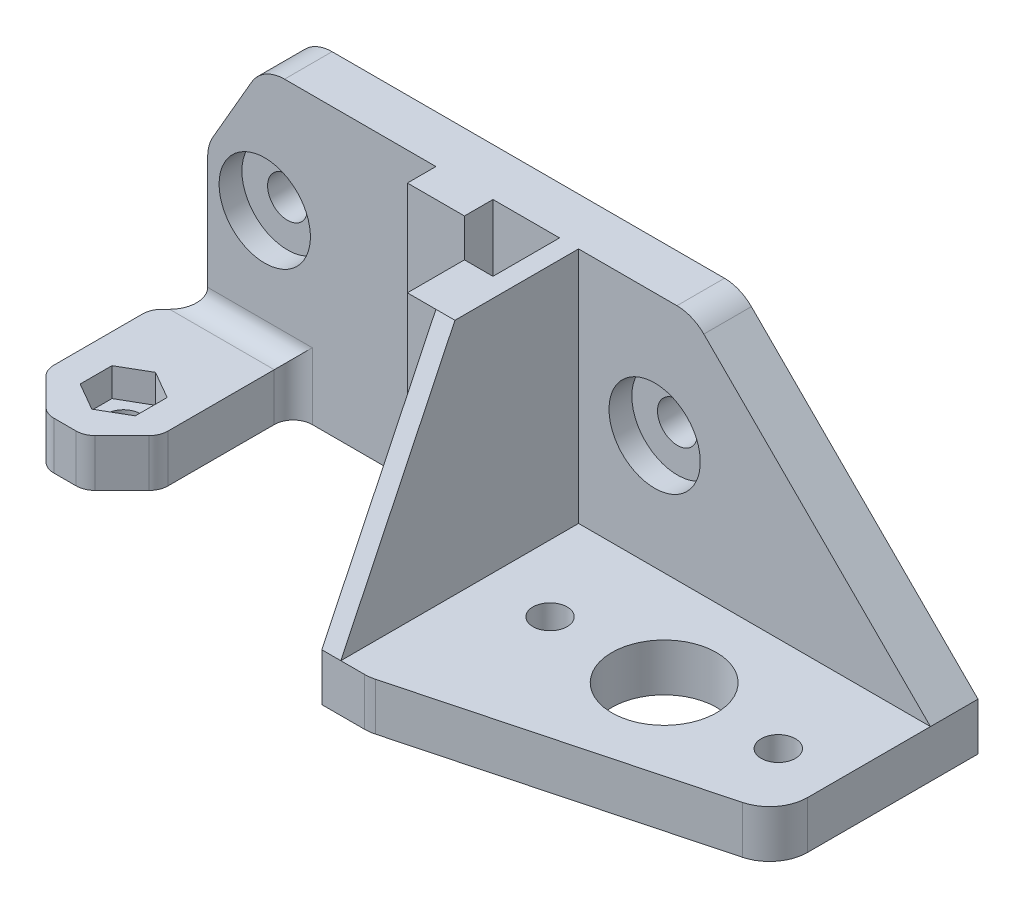
from build123d import *

# Parameters (mm, degrees)
SKETCH1_W                     = 30
SKETCH1_H                     = 30
BOSS_EXTRUDE1_DEPTH           = 30
SKETCH2_W                     = 20
SKETCH2_H                     = 20
CUT_EXTRUDE1_DEPTH            = 37.742346142
SKETCH3_W                     = 30
SKETCH3_H                     = 5
BOSS_EXTRUDE2_DEPTH           = 40
SKETCH4_R                     = 5.5
SKETCH4_R_2                   = 1.8
CUT_EXTRUDE2_DEPTH            = 65.420493634
CUT_EXTRUDE3_DEPTH            = 63.24949799
SKETCH5_W                     = 5
SKETCH5_H                     = 25
BOSS_EXTRUDE4_DEPTH           = 34
CHAMFER1_SIZE                 = 25
SKETCH8_R                     = 2.1
CUT_EXTRUDE4_DEPTH            = 63.657800791
SKETCH9_W                     = 5
SKETCH9_H                     = 30
BOSS_EXTRUDE5_DEPTH           = 12
CHAMFER2_SIZE                 = 10
CHAMFER2_SIZE2                = 5.773502692
SKETCH10_R                    = 2.1
CUT_EXTRUDE5_DEPTH            = 63.657800791
BODY_MOVE_COPY1_OUTLINE_R     = 1.8
BODY_MOVE_COPY1_OUTLINE_R_2   = 5.5
BODY_MOVE_COPY1_DEPTH         = 27.5685
BODY_MOVE_COPY1_2_OUTLINE_R   = 1.8
BODY_MOVE_COPY1_2_OUTLINE_R_2 = 5.5
BODY_MOVE_COPY1_2_DEPTH       = 5
BODY_MOVE_COPY1_START         = -15
BODY_MOVE_COPY1_3_DEPTH       = 5
BODY_MOVE_COPY1_4_DEPTH       = 5
SKETCH11_W                    = 3
SKETCH11_H                    = 25
CUT_EXTRUDE6_DEPTH            = 25
SKETCH12_W                    = 25
SKETCH12_H                    = 25
CUT_EXTRUDE7_DEPTH            = 60.380131357
SKETCH13_W                    = 3
SKETCH13_H                    = 6
SKETCH13_W_2                  = 6
SKETCH13_H_2                  = 3
BOSS_EXTRUDE6_DEPTH           = 30
SKETCH14_R                    = 4.8
CUT_EXTRUDE9_DEPTH            = 2.4
CHAMFER3_SIZE                 = 12
CHAMFER3_SIZE2                = 25
FILLET1_R                     = 4
FILLET2_R                     = 4
BODY_MOVE_COPY2_OUTLINE_R     = 1.8
BODY_MOVE_COPY2_OUTLINE_R_2   = 5.5
BODY_MOVE_COPY2_DEPTH         = 30
BODY_MOVE_COPY2_2_OUTLINE_R   = 1.8
BODY_MOVE_COPY2_2_OUTLINE_R_2 = 5.5
BODY_MOVE_COPY2_2_DEPTH       = 5
BODY_MOVE_COPY2_START         = -15
BODY_MOVE_COPY2_3_DEPTH       = 5
BODY_MOVE_COPY2_START_2       = -3
BODY_MOVE_COPY2_4_OUTLINE_W   = 5
BODY_MOVE_COPY2_4_OUTLINE_H   = 25
BODY_MOVE_COPY2_4_DEPTH       = 6
BODY_MOVE_COPY2_START_3       = -10
BODY_MOVE_COPY2_5_OUTLINE_W   = 2
BODY_MOVE_COPY2_5_OUTLINE_H   = 25
BODY_MOVE_COPY2_5_DEPTH       = 13
BODY_MOVE_COPY2_6_DEPTH       = 2.6
BODY_MOVE_COPY2_START_4       = 10
BODY_MOVE_COPY2_7_DEPTH       = 2
BODY_MOVE_COPY2_START_5       = 7
BODY_MOVE_COPY2_8_OUTLINE_W   = 25
BODY_MOVE_COPY2_8_OUTLINE_H   = 6
BODY_MOVE_COPY2_8_DEPTH       = 3.26576
BODY_MOVE_COPY2_START_6       = -16
BODY_MOVE_COPY2_9_DEPTH       = 6
BODY_MOVE_COPY2_START_7       = -12.4
BODY_MOVE_COPY2_10_DEPTH      = 2.4
SKETCH15_W                    = 13
SKETCH15_H                    = 5
BOSS_EXTRUDE7_DEPTH           = 18
SKETCH17_W                    = 23
SKETCH17_H                    = 5
BOSS_EXTRUDE8_DEPTH           = 3
SKETCH18_W                    = 4
SKETCH18_H                    = 18
CUT_EXTRUDE10_DEPTH           = 58.017541161
CHAMFER6_SIZE                 = 4
FILLET4_R                     = 2
SKETCH16_R                    = 1.8
CUT_EXTRUDE11_DEPTH           = 60.380131357
CUT_EXTRUDE12_DEPTH           = 3


with BuildPart() as part:
    # Sketch1 → Boss-Extrude1 (new body)
    with BuildSketch(Plane(origin=(0, 0, 0), x_dir=(1, 0, 0), z_dir=(0, 1, 0))):
        Rectangle(SKETCH1_W, SKETCH1_H)
    extrude(amount=BOSS_EXTRUDE1_DEPTH)

    # Sketch2 → Cut-Extrude1 (cut, through all)
    with BuildSketch(Plane(origin=(0, 30, 0), x_dir=(1, 0, 0), z_dir=(0, 1, 0))):
        Rectangle(SKETCH2_W, SKETCH2_H)
    extrude(amount=-CUT_EXTRUDE1_DEPTH, mode=Mode.SUBTRACT)

    # Sketch3 → Boss-Extrude2 (add)
    with BuildSketch(Plane(origin=(15, 0, 0), x_dir=(0, 0, -1), z_dir=(1, 0, 0))):
        with Locations((0, 2.5)):
            Rectangle(SKETCH3_W, SKETCH3_H)
    extrude(amount=BOSS_EXTRUDE2_DEPTH)

    # Sketch4 → Cut-Extrude2 (cut, through all)
    with BuildSketch(Plane.XZ):
        with Locations(Location((31, 0, 0), (0, 0, 270))):
            Circle(SKETCH4_R)
        with Locations(Location((19, 0, 0), (0, 0, 270))):
            Circle(SKETCH4_R_2)
        with Locations(Location((43, 0, 0), (0, 0, 270))):
            Circle(SKETCH4_R_2)
    extrude(amount=-CUT_EXTRUDE2_DEPTH, mode=Mode.SUBTRACT)

    # Sketch7 → Cut-Extrude3 (cut, through all)
    with BuildSketch(Plane(origin=(0, 5, 0), x_dir=(1, 0, 0), z_dir=(0, 1, 0))):
        Polygon((15, -15), (49, -6), (49, 15), (55, 15), (55, -15), align=None)
    extrude(amount=-CUT_EXTRUDE3_DEPTH, mode=Mode.SUBTRACT)

    # Sketch5 → Boss-Extrude4 (add)
    with BuildSketch(Plane(origin=(15, 0, 0), x_dir=(0, 0, -1), z_dir=(1, 0, 0))):
        with Locations((12.5, 17.5)):
            Rectangle(SKETCH5_W, SKETCH5_H)
    extrude(amount=BOSS_EXTRUDE4_DEPTH)

    # Chamfer1
    chamfer1_edges = [part.edges().sort_by_distance(p)[0] for p in [
        (49, 30, -12.5),
    ]]
    chamfer(chamfer1_edges, length=CHAMFER1_SIZE)

    # Sketch8 → Cut-Extrude4 (cut, through all)
    with BuildSketch(Plane.XY.offset(-10)):
        with Locations((20, 17)):
            Circle(SKETCH8_R)
    extrude(amount=-CUT_EXTRUDE4_DEPTH, mode=Mode.SUBTRACT)

    # Sketch9 → Boss-Extrude5 (add)
    with BuildSketch(Plane.ZY.offset(15)):
        with Locations((-12.5, 15)):
            Rectangle(SKETCH9_W, SKETCH9_H)
    extrude(amount=BOSS_EXTRUDE5_DEPTH)

    # Chamfer2
    chamfer2_edges = [part.edges().sort_by_distance(p)[0] for p in [
        (-27, 30, -12.5),
    ]]
    chamfer2_side = [part.faces().sort_by_distance(p)[0] for p in [
        (-27, 15, -12.5),
    ]]
    chamfer(chamfer2_edges, length=CHAMFER2_SIZE, length2=CHAMFER2_SIZE2, reference=chamfer2_side[0])

    # Sketch10 → Cut-Extrude5 (cut, through all)
    with BuildSketch(Plane.XY.offset(-10)):
        with Locations((-21, 17)):
            Circle(SKETCH10_R)
    extrude(amount=-CUT_EXTRUDE5_DEPTH, mode=Mode.SUBTRACT)

    # Body-Move/Copy1: read off the stored shape, not the designer's step
    # Body-Move/Copy1 outline → Body-Move/Copy1 (cut)
    with BuildSketch(Plane(origin=(0, 0, 0), x_dir=(1, 0, 0), z_dir=(0, 1, 0))):
        Polygon((27, 10), (15, 10), (15, -15), (49, -6), (49, 15), (27, 15), align=None)
        with Locations((19, 0)):
            Circle(BODY_MOVE_COPY1_OUTLINE_R, mode=Mode.SUBTRACT)
        with Locations((31, 0)):
            Circle(BODY_MOVE_COPY1_OUTLINE_R_2, mode=Mode.SUBTRACT)
        with Locations((43, 0)):
            Circle(BODY_MOVE_COPY1_OUTLINE_R, mode=Mode.SUBTRACT)
    extrude(amount=BODY_MOVE_COPY1_DEPTH, mode=Mode.SUBTRACT)

    # Body-Move_Copy1 2 outline → Body-Move_Copy1 2 (add)
    with BuildSketch(Plane(origin=(0, 0, 0), x_dir=(1, 0, 0), z_dir=(0, 1, 0))):
        Polygon((-27, 10), (-27, 15), (-49, 15), (-49, -6), (-15, -15), (-15, 10), align=None)
        with Locations((-19, 0)):
            Circle(BODY_MOVE_COPY1_2_OUTLINE_R, mode=Mode.SUBTRACT)
        with Locations((-43, 0)):
            Circle(BODY_MOVE_COPY1_2_OUTLINE_R, mode=Mode.SUBTRACT)
        with Locations((-31, 0)):
            Circle(BODY_MOVE_COPY1_2_OUTLINE_R_2, mode=Mode.SUBTRACT)
    extrude(amount=BODY_MOVE_COPY1_2_DEPTH)

    # Body-Move_Copy1 3 outline → Body-Move_Copy1 3 (cut)
    with BuildSketch(Plane.XY.offset(BODY_MOVE_COPY1_START)):
        Polygon((24, 30), (21.226497308, 30), (27, 20), (27, 27), align=None)
        with BuildLine():
            ThreePointArc((-20.5, 14.960392195), (-17.9, 17), (-20.5, 19.039607805))
            ThreePointArc((-20.5, 19.039607805), (-18.9, 17), (-20.5, 14.960392195))
        make_face()
        with BuildLine():
            ThreePointArc((20.5, 14.960392195), (23.1, 17), (20.5, 19.039607805))
            ThreePointArc((20.5, 19.039607805), (22.1, 17), (20.5, 14.960392195))
        make_face()
    extrude(amount=BODY_MOVE_COPY1_3_DEPTH, mode=Mode.SUBTRACT)

    # Body-Move_Copy1 4 outline → Body-Move_Copy1 4 (add)
    with BuildSketch(Plane.XY.offset(BODY_MOVE_COPY1_START)):
        Polygon((-27, 20), (-21.226497308, 30), (-24, 30), (-49, 5), (-27, 5), align=None)
        with BuildLine():
            ThreePointArc((-20.5, 14.960392195), (-22.1, 17), (-20.5, 19.039607805))
            ThreePointArc((-20.5, 19.039607805), (-23.1, 17), (-20.5, 14.960392195))
        make_face()
        with BuildLine():
            ThreePointArc((20.5, 14.960392195), (18.9, 17), (20.5, 19.039607805))
            ThreePointArc((20.5, 19.039607805), (17.9, 17), (20.5, 14.960392195))
        make_face()
    extrude(amount=BODY_MOVE_COPY1_4_DEPTH)

    # Sketch11 → Cut-Extrude6 (cut)
    with BuildSketch(Plane(origin=(0, 30, 0), x_dir=(1, 0, 0), z_dir=(0, 1, 0))):
        with Locations((-13.5, -2.5)):
            Rectangle(SKETCH11_W, SKETCH11_H)
    extrude(amount=-CUT_EXTRUDE6_DEPTH, mode=Mode.SUBTRACT)

    # Sketch12 → Cut-Extrude7 (cut, through all)
    with BuildSketch(Plane(origin=(0, 30, 0), x_dir=(1, 0, 0), z_dir=(0, 1, 0))):
        with Locations((2.5, -2.5)):
            Rectangle(SKETCH12_W, SKETCH12_H)
    extrude(amount=-CUT_EXTRUDE7_DEPTH, mode=Mode.SUBTRACT)

    # Sketch13 → Boss-Extrude6 (add)
    with BuildSketch(Plane(origin=(0, 30, 0), x_dir=(1, 0, 0), z_dir=(0, 1, 0))):
        with Locations((-8.5, 0)):
            Rectangle(SKETCH13_W, SKETCH13_H)
        with Locations((0, 8.5)):
            Rectangle(SKETCH13_W_2, SKETCH13_H_2)
    extrude(amount=-BOSS_EXTRUDE6_DEPTH)

    # Sketch14 → Cut-Extrude9 (cut)
    with BuildSketch(Plane.XY.offset(-10)):
        with Locations((-20, 17)):
            Circle(SKETCH14_R)
        with Locations((21, 17)):
            Circle(SKETCH14_R)
    extrude(amount=-CUT_EXTRUDE9_DEPTH, mode=Mode.SUBTRACT)

    # Chamfer3
    chamfer3_edges = [part.edges().sort_by_distance(p)[0] for p in [
        (-11, 30, 15),
    ]]
    chamfer3_side = [part.faces().sort_by_distance(p)[0] for p in [
        (-18, 30, -10.542718717),
    ]]
    chamfer(chamfer3_edges, length=CHAMFER3_SIZE, length2=CHAMFER3_SIZE2, reference=chamfer3_side[0])

    # Fillet1
    fillet1_edges = [part.edges().sort_by_distance(p)[0] for p in [
        (-15, 2.5, 15),
        (-49, 2.5, 6),
    ]]
    fillet(fillet1_edges, radius=FILLET1_R)

    # Fillet2
    fillet2_edges = [part.edges().sort_by_distance(p)[0] for p in [
        (27, 20, -12.5),
        (21.226497308, 30, -12.5),
        (-24, 30, -12.5),
    ]]
    fillet(fillet2_edges, radius=FILLET2_R)

    # Body-Move/Copy2: read off the stored shape, not the designer's step
    # Body-Move/Copy2 outline → Body-Move/Copy2 (cut)
    with BuildSketch(Plane(origin=(0, 0, 0), x_dir=(1, 0, 0), z_dir=(0, 1, 0))):
        with BuildLine():
            Line((-10, 3), (-10, 10))
            Line((-10, 10), (-27, 10))
            Line((-27, 10), (-27, 15))
            Line((-27, 15), (-49, 15))
            Line((-49, 15), (-49, -2.921057554))
            ThreePointArc((-49, -2.921057554), (-48.169722461, -5.360905811), (-46.023570241, -6.787878466))
            Line((-46.023570241, -6.787878466), (-15.503121001, -14.866820911))
            ThreePointArc((-15.503121001, -14.866820911), (-14.995649759, -14.966565495), (-14.47955076, -15))
            Line((-14.47955076, -15), (-10, -15))
            Line((-10, -15), (-10, -3))
            Line((-10, -3), (-7, -3))
            Line((-7, -3), (-7, 3))
            Line((-7, 3), (-10, 3))
        make_face()
        with Locations((-19, 0)):
            Circle(BODY_MOVE_COPY2_OUTLINE_R, mode=Mode.SUBTRACT)
        with Locations((-43, 0)):
            Circle(BODY_MOVE_COPY2_OUTLINE_R, mode=Mode.SUBTRACT)
        with Locations((-31, 0)):
            Circle(BODY_MOVE_COPY2_OUTLINE_R_2, mode=Mode.SUBTRACT)
    extrude(amount=BODY_MOVE_COPY2_DEPTH, mode=Mode.SUBTRACT)

    # Body-Move_Copy2 2 outline → Body-Move_Copy2 2 (add)
    with BuildSketch(Plane(origin=(0, 0, 0), x_dir=(1, 0, 0), z_dir=(0, 1, 0))):
        with BuildLine():
            Line((49, 15), (27, 15))
            Line((27, 15), (27, 10))
            Line((27, 10), (10, 10))
            Line((10, 10), (10, 3))
            Line((10, 3), (7, 3))
            Line((7, 3), (7, -3))
            Line((7, -3), (10, -3))
            Line((10, -3), (10, -15))
            Line((10, -15), (14.47955076, -15))
            ThreePointArc((14.47955076, -15), (14.995649759, -14.966565495), (15.503121001, -14.866820911))
            Line((15.503121001, -14.866820911), (46.023570241, -6.787878466))
            ThreePointArc((46.023570241, -6.787878466), (48.169722461, -5.360905811), (49, -2.921057554))
            Line((49, -2.921057554), (49, 15))
        make_face()
        with Locations((43, 0)):
            Circle(BODY_MOVE_COPY2_2_OUTLINE_R, mode=Mode.SUBTRACT)
        with Locations((19, 0)):
            Circle(BODY_MOVE_COPY2_2_OUTLINE_R, mode=Mode.SUBTRACT)
        with Locations((31, 0)):
            Circle(BODY_MOVE_COPY2_2_OUTLINE_R_2, mode=Mode.SUBTRACT)
    extrude(amount=BODY_MOVE_COPY2_2_DEPTH)

    # Body-Move_Copy2 3 outline → Body-Move_Copy2 3 (add)
    with BuildSketch(Plane.XY.offset(BODY_MOVE_COPY2_START)):
        with BuildLine():
            Line((27, 5), (49, 5))
            Line((49, 5), (25.171572875, 28.828427125))
            ThreePointArc((25.171572875, 28.828427125), (23.87387948, 29.69551813), (22.343145751, 30))
            Line((22.343145751, 30), (18.917096231, 30))
            ThreePointArc((18.917096231, 30), (20.917096231, 29.464101615), (22.381197846, 28))
            Line((22.381197846, 28), (26.464101615, 20.92820323))
            ThreePointArc((26.464101615, 20.92820323), (26.863703305, 19.96347941), (27, 18.92820323))
            Line((27, 18.92820323), (27, 5))
        make_face()
        with BuildLine():
            ThreePointArc((20.5, 21.773887305), (24.8, 17), (20.5, 12.226112695))
            ThreePointArc((20.5, 12.226112695), (25.8, 17), (20.5, 21.773887305))
        make_face()
        with BuildLine():
            ThreePointArc((-20.5, 21.773887305), (-16.2, 17), (-20.5, 12.226112695))
            ThreePointArc((-20.5, 12.226112695), (-15.2, 17), (-20.5, 21.773887305))
        make_face()
    extrude(amount=BODY_MOVE_COPY2_3_DEPTH)

    # Body-Move_Copy2 4 outline → Body-Move_Copy2 4 (add)
    with BuildSketch(Plane.XY.offset(BODY_MOVE_COPY2_START_2)):
        with Locations((9.5, 17.5)):
            Rectangle(BODY_MOVE_COPY2_4_OUTLINE_W, BODY_MOVE_COPY2_4_OUTLINE_H)
    extrude(amount=BODY_MOVE_COPY2_4_DEPTH)

    # Body-Move_Copy2 5 outline → Body-Move_Copy2 5 (add)
    with BuildSketch(Plane.XY.offset(BODY_MOVE_COPY2_START_3)):
        with Locations((11, 17.5)):
            Rectangle(BODY_MOVE_COPY2_5_OUTLINE_W, BODY_MOVE_COPY2_5_OUTLINE_H)
    extrude(amount=BODY_MOVE_COPY2_5_DEPTH)

    # Body-Move_Copy2 6 outline → Body-Move_Copy2 6 (add)
    with BuildSketch(Plane.XY.offset(BODY_MOVE_COPY2_START)):
        with BuildLine():
            ThreePointArc((-20.5, 19.039607805), (-18.9, 17), (-20.5, 14.960392195))
            ThreePointArc((-20.5, 14.960392195), (-17.9, 17), (-20.5, 19.039607805))
        make_face()
        with BuildLine():
            ThreePointArc((20.5, 19.039607805), (22.1, 17), (20.5, 14.960392195))
            ThreePointArc((20.5, 14.960392195), (23.1, 17), (20.5, 19.039607805))
        make_face()
    extrude(amount=BODY_MOVE_COPY2_6_DEPTH)

    # Body-Move_Copy2 7 outline → Body-Move_Copy2 7 (add)
    with BuildSketch(Plane.YZ.offset(BODY_MOVE_COPY2_START_4)):
        Polygon((5, 15), (5, -10), (30, -10), (30, 3), align=None)
    extrude(amount=BODY_MOVE_COPY2_7_DEPTH)

    # Body-Move_Copy2 8 outline → Body-Move_Copy2 8 (add)
    with BuildSketch(Plane.YZ.offset(BODY_MOVE_COPY2_START_5)):
        with Locations((17.5, 0)):
            Rectangle(BODY_MOVE_COPY2_8_OUTLINE_W, BODY_MOVE_COPY2_8_OUTLINE_H)
    extrude(amount=BODY_MOVE_COPY2_8_DEPTH)

    # Body-Move_Copy2 9 outline → Body-Move_Copy2 9 (cut)
    with BuildSketch(Plane.XY.offset(BODY_MOVE_COPY2_START_6)):
        with BuildLine():
            ThreePointArc((-20.5, 14.960392195), (-22.1, 17), (-20.5, 19.039607805))
            ThreePointArc((-20.5, 19.039607805), (-23.1, 17), (-20.5, 14.960392195))
        make_face()
        with BuildLine():
            ThreePointArc((20.5, 14.960392195), (18.9, 17), (20.5, 19.039607805))
            ThreePointArc((20.5, 19.039607805), (17.9, 17), (20.5, 14.960392195))
        make_face()
        with BuildLine():
            ThreePointArc((-22.381197846, 28), (-20.917096231, 29.464101615), (-18.917096231, 30))
            Line((-18.917096231, 30), (-22.343145751, 30))
            ThreePointArc((-22.343145751, 30), (-23.87387948, 29.69551813), (-25.171572875, 28.828427125))
            Line((-25.171572875, 28.828427125), (-27, 27))
            Line((-27, 27), (-27, 18.92820323))
            ThreePointArc((-27, 18.92820323), (-26.863703305, 19.96347941), (-26.464101615, 20.92820323))
            Line((-26.464101615, 20.92820323), (-22.381197846, 28))
        make_face()
    extrude(amount=BODY_MOVE_COPY2_9_DEPTH, mode=Mode.SUBTRACT)

    # Body-Move_Copy2 10 outline → Body-Move_Copy2 10 (cut)
    with BuildSketch(Plane.XY.offset(BODY_MOVE_COPY2_START_7)):
        with BuildLine():
            ThreePointArc((20.5, 12.226112695), (16.2, 17), (20.5, 21.773887305))
            ThreePointArc((20.5, 21.773887305), (15.2, 17), (20.5, 12.226112695))
        make_face()
        with BuildLine():
            ThreePointArc((-20.5, 12.226112695), (-24.8, 17), (-20.5, 21.773887305))
            ThreePointArc((-20.5, 21.773887305), (-25.8, 17), (-20.5, 12.226112695))
        make_face()
    extrude(amount=BODY_MOVE_COPY2_10_DEPTH, mode=Mode.SUBTRACT)

    # Sketch15 → Boss-Extrude7 (add)
    with BuildSketch(Plane.XY.offset(-10)):
        with Locations((-20.5, 2.5)):
            Rectangle(SKETCH15_W, SKETCH15_H)
    extrude(amount=BOSS_EXTRUDE7_DEPTH)

    # Sketch17 → Boss-Extrude8 (add)
    with BuildSketch(Plane.ZY.offset(27)):
        with Locations((-3.5, 2.5)):
            Rectangle(SKETCH17_W, SKETCH17_H)
    extrude(amount=BOSS_EXTRUDE8_DEPTH)

    # Sketch18 → Cut-Extrude10 (cut, through all)
    with BuildSketch(Plane(origin=(0, 5, 0), x_dir=(1, 0, 0), z_dir=(0, 1, 0))):
        Polygon((-27, 10), (-30, 7), (-30, 15), (-27, 15), align=None)
        with Locations((-16, 1)):
            Rectangle(SKETCH18_W, SKETCH18_H)
    extrude(amount=-CUT_EXTRUDE10_DEPTH, mode=Mode.SUBTRACT)

    # Chamfer6
    chamfer6_edges = [part.edges().sort_by_distance(p)[0] for p in [
        (-30, 2.5, 8),
        (-18, 2.5, 8),
    ]]
    chamfer(chamfer6_edges, length=CHAMFER6_SIZE)

    # Fillet4
    fillet4_edges = [part.edges().sort_by_distance(p)[0] for p in [
        (-30, 2.5, -7),
        (-22.5, 5, -10),
        (-18, 2.5, -10),
        (-26, 2.5, 8),
        (-22, 2.5, 8),
        (-18, 2.5, 4),
        (-30, 2.5, 4),
    ]]
    fillet(fillet4_edges, radius=FILLET4_R)

    # Sketch16 → Cut-Extrude11 (cut, through all)
    with BuildSketch(Plane.XZ):
        with Locations(Location((-24, 1.835210164, 0), (0, 0, 270))):
            Circle(SKETCH16_R)
    extrude(amount=-CUT_EXTRUDE11_DEPTH, mode=Mode.SUBTRACT)

    # Sketch19 → Cut-Extrude12 (cut)
    with BuildSketch(Plane(origin=(0, 5, 0), x_dir=(1, 0, 0), z_dir=(0, 1, 0))):
        Polygon((-21.1, -0.160894384), (-24, 1.513421397), (-26.9, -0.160894384), (-26.9, -3.509525945), (-24, -5.183841726), (-21.1, -3.509525945), align=None)
    extrude(amount=-CUT_EXTRUDE12_DEPTH, mode=Mode.SUBTRACT)


solid = part.part
